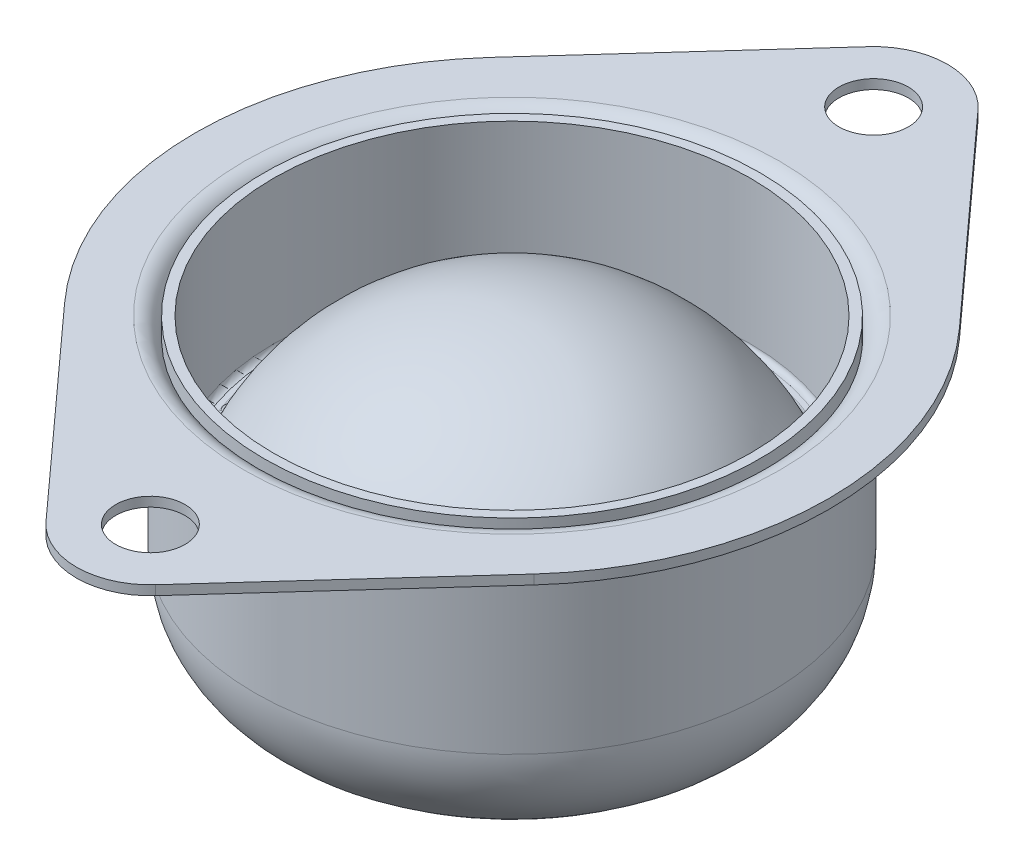
from build123d import *

# Parameters (mm, degrees)
SKETCH1_R           = 2.778125
BOSS_EXTRUDE1_DEPTH = 0.762
SKETCH2_R           = 20.6375
BOSS_EXTRUDE2_DEPTH = 23.84425
FILLET1_R           = 8.73125
FILLET2_R           = 1.5875
SKETCH6_R           = 11.90625
CUT_EXTRUDE3_DEPTH  = 0.762
SKETCH7_R           = 19.8755
BOSS_EXTRUDE3_DEPTH = 12.7
FILLET3_R           = 1.190625
SHELL2_T            = -0.762


# Read off the part's stored shape, not the designer's step: Shell1
with BuildPart() as part:
    # Sketch1 → Boss-Extrude1 (new body)
    with BuildSketch(Plane(origin=(0, 0, 0), x_dir=(1, 0, 0), z_dir=(0, 1, 0))):
        with BuildLine():
            Line((18.820325042, -17.057413793), (4.390174247, -32.978943966))
            ThreePointArc((4.390174247, -32.978943966), (0, -34.925), (-4.390174247, -32.978943966))
            Line((-4.390174247, -32.978943966), (-18.820325042, -17.057413793))
            ThreePointArc((-18.820325042, -17.057413793), (-25.4, 0), (-18.820325042, 17.057413793))
            Line((-18.820325042, 17.057413793), (-4.390174247, 32.978943966))
            ThreePointArc((-4.390174247, 32.978943966), (0, 34.925), (4.390174247, 32.978943966))
            Line((4.390174247, 32.978943966), (18.820325042, 17.057413793))
            ThreePointArc((18.820325042, 17.057413793), (25.4, 0), (18.820325042, -17.057413793))
        make_face()
        with Locations(Location((0, 29, 0), (0, 0, 90))):
            Circle(SKETCH1_R, mode=Mode.SUBTRACT)
        with Locations(Location((0, -29, 0), (0, 0, 90))):
            Circle(SKETCH1_R, mode=Mode.SUBTRACT)
    extrude(amount=BOSS_EXTRUDE1_DEPTH)

    # Sketch2 → Boss-Extrude2 (add)
    with BuildSketch(Plane.XZ):
        with Locations(Location((0, 0, 0), (0, 0, 90))):
            Circle(SKETCH2_R)
    extrude(amount=BOSS_EXTRUDE2_DEPTH)

    # Fillet1
    fillet1_edges = [part.edges().sort_by_distance(p)[0] for p in [
        (0, -23.84425, -20.6375),
    ]]
    fillet(fillet1_edges, radius=FILLET1_R)

    # Shell1 outline → Shell1 (revolve, cut)
    with BuildSketch(Plane.XY):
        with BuildLine():
            ThreePointArc((11.90625, -23.08225), (17.541360716, -20.748110716), (19.8755, -15.113))
            Line((19.8755, -15.113), (19.8755, 0.762))
            Line((19.8755, 0.762), (0, 0.762))
            Line((0, 0.762), (0, -23.08225))
            Line((0, -23.08225), (11.90625, -23.08225))
        make_face()
    revolve(axis=Axis((0, 0, 0), (0, 1, 0)), mode=Mode.SUBTRACT)

    # Fillet2
    fillet2_edges = [part.edges().sort_by_distance(p)[0] for p in [
        (0, 0, -20.6375),
        (-19.8755, 0.762, 0),
    ]]
    fillet(fillet2_edges, radius=FILLET2_R)

    # Sketch6 → Cut-Extrude3 (cut)
    with BuildSketch(Plane.XZ.offset(23.84425)):
        with Locations(Location((0, 0, 0), (0, 0, 90))):
            Circle(SKETCH6_R)
    extrude(amount=-CUT_EXTRUDE3_DEPTH, mode=Mode.SUBTRACT)


with BuildPart() as body_2:
    # Sketch7 → Boss-Extrude3 (new body)
    with BuildSketch(Plane(origin=(0, 0.762, 0), x_dir=(1, 0, 0), z_dir=(0, 1, 0))):
        with Locations(Location((0, 0, 0), (0, 0, 270))):
            Circle(SKETCH7_R)
    extrude(amount=-BOSS_EXTRUDE3_DEPTH)

    # Sketch8 → Cut-Revolve1 (revolve, cut)
    with BuildSketch(Plane(origin=(0, 0, 0), x_dir=(0, 0, -1), z_dir=(1, 0, 0))):
        with BuildLine():
            Line((0, 0), (0, -11.938))
            Line((0, -11.938), (-17.4625, -11.938))
            ThreePointArc((-17.4625, -11.938), (-10.576563126, -3.269738778), (0, 0))
        make_face()
    revolve(axis=Axis((0, -30.908625, 0), (0, 1, 0)), mode=Mode.SUBTRACT)

    # Fillet3
    fillet3_edges = [body_2.edges().sort_by_distance(p)[0] for p in [
        (0, -11.938, -19.8755),
        (0, -11.938, -17.4625),
    ]]
    fillet(fillet3_edges, radius=FILLET3_R)

    # Shell2
    shell2_openings = [body_2.faces().sort_by_distance(p)[0] for p in [
        (0, 0.762, 0),
    ]]
    offset(amount=SHELL2_T, openings=shell2_openings, kind=Kind.INTERSECTION)


with BuildPart() as body_3:
    # Sketch3 → Revolve1 (revolve)
    with BuildSketch(Plane(origin=(0, 0, 0), x_dir=(0, 0, -1), z_dir=(1, 0, 0))):
        with BuildLine():
            Line((0, -29.4005), (0, -4.0005))
            ThreePointArc((0, -4.0005), (-12.7, -16.7005), (0, -29.4005))
        make_face()
    revolve(axis=Axis((0, -106.822164787, 0), (0, 1, 0)))


solid = Compound([part.part, body_2.part, body_3.part])
